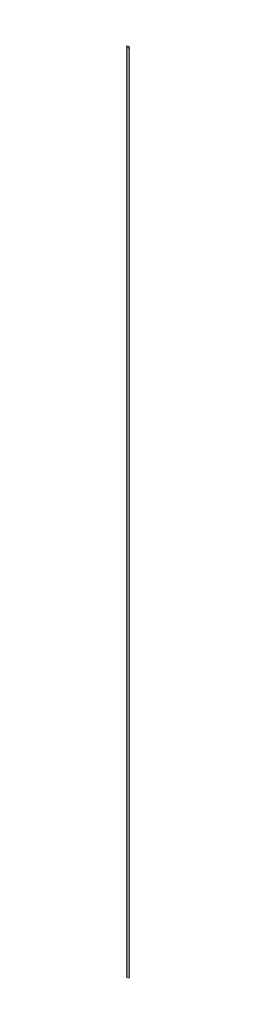
from build123d import *


with BuildPart() as part:
    # Sweep1: sweep along a path in Sketch2
    with BuildLine(Plane(origin=(0, 0, 0), x_dir=(0, 0, -1), z_dir=(1, 0, 0))) as sweep1_path:
        Line((0, 0), (0, 30378.4))
    # Sketch1 → Sweep1 (sweep)
    with BuildSketch(Plane(origin=(0, 0, 0), x_dir=(1, 0, 0), z_dir=(0, 1, 0))):
        with BuildLine():
            Line((0, 31.75), (38.1, 31.75))
            ThreePointArc((38.1, 31.75), (69.85, 0), (38.1, -31.75))
            Line((38.1, -31.75), (0, -31.75))
            ThreePointArc((0, -31.75), (-31.75, 0), (0, 31.75))
        make_face()
        with BuildLine():
            Line((0, 20.304779167), (38.1, 20.304779167))
            ThreePointArc((38.1, 20.304779167), (58.404779167, 0), (38.1, -20.304779167))
            Line((38.1, -20.304779167), (0, -20.304779167))
            ThreePointArc((0, -20.304779167), (-20.304779167, 0), (0, 20.304779167))
        make_face(mode=Mode.SUBTRACT)
    sweep(path=sweep1_path.line)


solid = part.part
